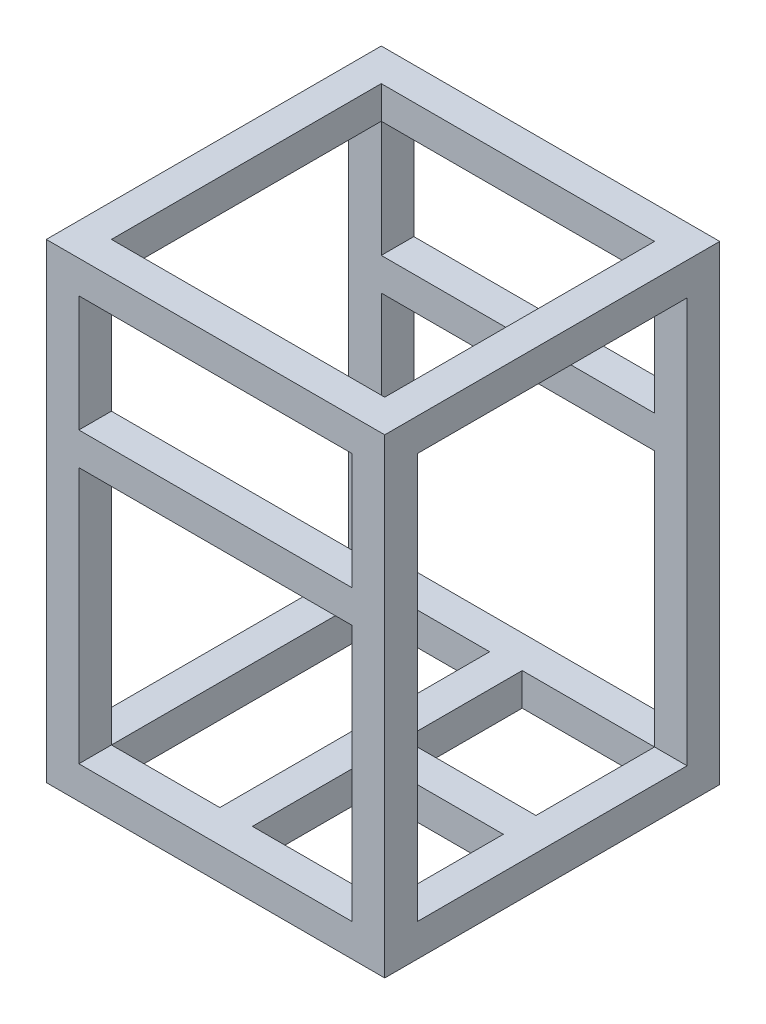
from build123d import *

# Parameters (mm, degrees)
CROQUIS1_W              = 131.9512
CROQUIS1_H              = 130.6
CROQUIS1_W_2            = 42.2512
CROQUIS1_H_2            = 105.2
CROQUIS1_W_3            = 51.6
CROQUIS1_H_3            = 46.25
SALIENTE_EXTRUIR1_DEPTH = 12.7
CROQUIS2_W              = 12.7
CROQUIS2_H              = 12.7
SALIENTE_EXTRUIR2_DEPTH = 158
CROQUIS3_W              = 131.9512
CROQUIS3_H              = 130.6
CROQUIS3_W_2            = 106.5512
CROQUIS3_H_2            = 105.2
SALIENTE_EXTRUIR3_DEPTH = 12.7
SALIENTE_EXTRUIR4_REACH = 256.78
CROQUIS4_W              = 12.7
CROQUIS4_H              = 12.7


with BuildPart() as part:
    # Croquis1 → Saliente-Extruir1 (new body)
    with BuildSketch(Plane(origin=(0, 0, 0), x_dir=(1, 0, 0), z_dir=(0, 1, 0))):
        with Locations((65.9756, 65.3)):
            Rectangle(CROQUIS1_W, CROQUIS1_H)
        with Locations((33.8256, 65.3)):
            Rectangle(CROQUIS1_W_2, CROQUIS1_H_2, mode=Mode.SUBTRACT)
        with Locations((93.4512, 35.825)):
            Rectangle(CROQUIS1_W_3, CROQUIS1_H_3, mode=Mode.SUBTRACT)
        with Locations((93.4512, 94.775)):
            Rectangle(CROQUIS1_W_3, CROQUIS1_H_3, mode=Mode.SUBTRACT)
    extrude(amount=SALIENTE_EXTRUIR1_DEPTH)

    # Croquis2 → Saliente-Extruir2 (add)
    with BuildSketch(Plane(origin=(0, 12.7, 0), x_dir=(1, 0, 0), z_dir=(0, 1, 0))):
        with Locations((6.35, 124.25)):
            Rectangle(CROQUIS2_W, CROQUIS2_H)
        with Locations((6.35, 6.35)):
            Rectangle(CROQUIS2_W, CROQUIS2_H)
        with Locations((125.6012, 124.25)):
            Rectangle(CROQUIS2_W, CROQUIS2_H)
        with Locations((125.6012, 6.35)):
            Rectangle(CROQUIS2_W, CROQUIS2_H)
    extrude(amount=SALIENTE_EXTRUIR2_DEPTH)

    # Croquis3 → Saliente-Extruir3 (add)
    with BuildSketch(Plane(origin=(0, 170.7, 0), x_dir=(1, 0, 0), z_dir=(0, 1, 0))):
        with Locations((65.9756, 65.3)):
            Rectangle(CROQUIS3_W, CROQUIS3_H)
        with Locations((65.9756, 65.3)):
            Rectangle(CROQUIS3_W_2, CROQUIS3_H_2, mode=Mode.SUBTRACT)
    extrude(amount=SALIENTE_EXTRUIR3_DEPTH)

    # Croquis4 → Saliente-Extruir4 (add, up to next)
    with BuildSketch(Plane.ZY.offset(-119.2512), mode=Mode.PRIVATE) as saliente_extruir4_sk1:
        with Locations((-6.35, 119.05)):
            Rectangle(CROQUIS4_W, CROQUIS4_H)
    saliente_extruir4_tool1 = extrude(saliente_extruir4_sk1.sketch, amount=SALIENTE_EXTRUIR4_REACH, mode=Mode.PRIVATE) - part.part
    # Croquis4 → Saliente-Extruir4 (add, up to next)
    with BuildSketch(Plane.ZY.offset(-119.2512), mode=Mode.PRIVATE) as saliente_extruir4_sk2:
        with Locations((-124.25, 119.05)):
            Rectangle(CROQUIS4_W, CROQUIS4_H)
    saliente_extruir4_tool2 = extrude(saliente_extruir4_sk2.sketch, amount=SALIENTE_EXTRUIR4_REACH, mode=Mode.PRIVATE) - part.part
    add(saliente_extruir4_tool1.solids().sort_by_distance((119.2512, 119.05, -6.35))[0])
    add(saliente_extruir4_tool2.solids().sort_by_distance((119.2512, 119.05, -124.25))[0])


solid = part.part
